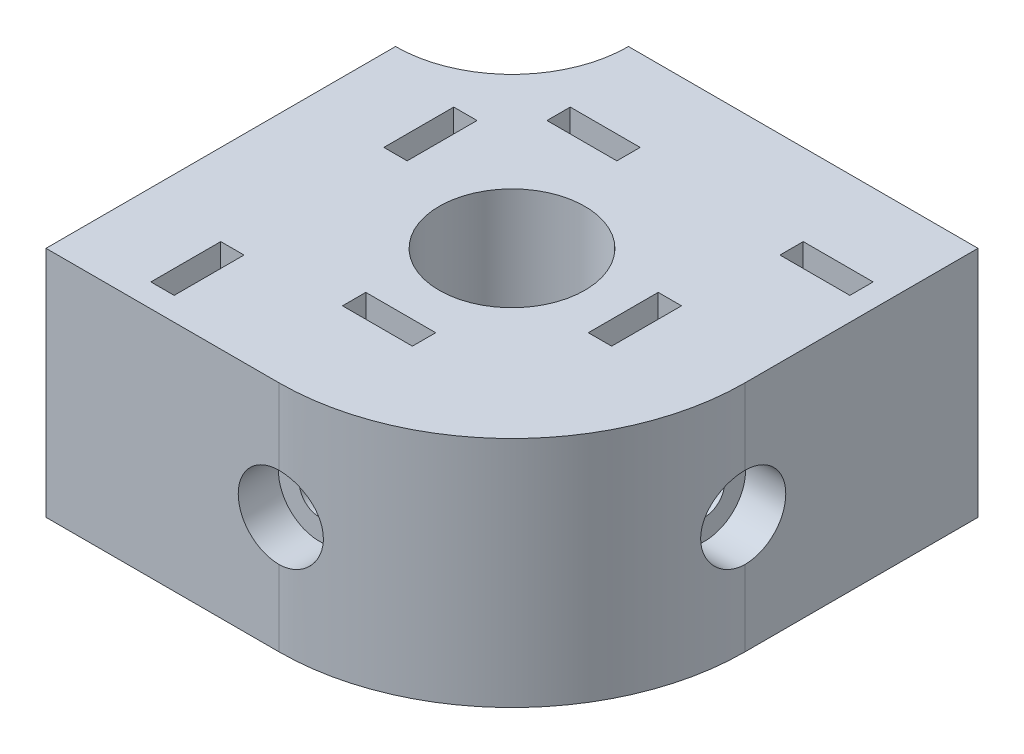
from build123d import *

# Parameters (mm, degrees)
SKETCH1_W               = 40
SKETCH1_H               = 40
SKETCH1_R               = 6.25
BOSS_EXTRUDE1_DEPTH     = 20
SKETCH2_R               = 1.7
CUT_EXTRUDE1_DEPTH      = 11
CUT_EXTRUDE2_START      = -7
CUT_EXTRUDE2_DEPTH      = 2
CUT_EXTRUDE3_REACH      = 50.99
CUT_EXTRUDE3_END_RADIUS = 6.25
SKETCH4_R               = 1.7
CUT_EXTRUDE4_START      = -8.45
CUT_EXTRUDE4_DEPTH      = 2
SKETCH6_R               = 3.5
CUT_EXTRUDE5_DEPTH      = 3.45
FILLET1_R               = 20
CUT_EXTRUDE6_DEPTH      = 35.641016325


with BuildPart() as part:
    # Sketch1 → Boss-Extrude1 (new body)
    with BuildSketch(Plane(origin=(0, 0, 0), x_dir=(1, 0, 0), z_dir=(0, 1, 0))):
        Rectangle(SKETCH1_W, SKETCH1_H)
        with Locations(Location((0, 0, 0), (0, 0, 270))):
            Circle(SKETCH1_R, mode=Mode.SUBTRACT)
    extrude(amount=BOSS_EXTRUDE1_DEPTH)

    # Sketch2 → Cut-Extrude1 (cut)
    with BuildSketch(Plane.ZY.offset(20)):
        with Locations((-5, 15)):
            Circle(SKETCH2_R)
        with Locations((15, 15)):
            Circle(SKETCH2_R)
        with Locations((0, 5)):
            Circle(SKETCH2_R)
    cut_extrude1 = extrude(amount=-CUT_EXTRUDE1_DEPTH, mode=Mode.SUBTRACT)

    # Sketch3 → Cut-Extrude2 (cut)
    with BuildSketch(Plane.ZY.offset(20).offset(CUT_EXTRUDE2_START)):
        Polygon((-8, 12), (-2, 12), (-2, 18), (-2, 20), (-8, 20), (-8, 18), align=None)
        Polygon((12, 12), (18, 12), (18, 18), (18, 20), (12, 20), (12, 18), align=None)
        Polygon((-3, 8), (3, 8), (3, 2), (3, 0), (-3, 0), (-3, 2), align=None)
    cut_extrude2 = extrude(amount=-CUT_EXTRUDE2_DEPTH, mode=Mode.SUBTRACT)

    # Cut-Extrude3: up to this cylinder (the profile starts outside it)
    cut_extrude3_end = Plane(origin=(0, 10, 0), z_dir=(0, -1, 0)) * Cylinder(CUT_EXTRUDE3_END_RADIUS, 115.48, mode=Mode.PRIVATE)
    # Sketch4 → Cut-Extrude3 (cut, up to the surface)
    with BuildSketch(Plane.XY.offset(20), mode=Mode.PRIVATE) as cut_extrude3_sk1:
        with Locations((0, 10)):
            Circle(SKETCH4_R)
    cut_extrude3_tool1 = extrude(cut_extrude3_sk1.sketch, amount=-CUT_EXTRUDE3_REACH, mode=Mode.PRIVATE) - cut_extrude3_end
    cut_extrude3 = cut_extrude3_tool1.solids().sort_by_distance((0, 10, 20))[0]
    add(cut_extrude3, mode=Mode.SUBTRACT)

    # Sketch5 → Cut-Extrude4 (cut)
    with BuildSketch(Plane.XY.offset(20).offset(CUT_EXTRUDE4_START)):
        Polygon((-3, 13), (-3, 20), (3, 20), (3, 13), (3, 7), (-3, 7), align=None)
    cut_extrude4 = extrude(amount=-CUT_EXTRUDE4_DEPTH, mode=Mode.SUBTRACT)

    # Sketch6 → Cut-Extrude5 (cut)
    with BuildSketch(Plane.XY.offset(20)):
        with Locations((0, 10)):
            Circle(SKETCH6_R)
    cut_extrude5 = extrude(amount=-CUT_EXTRUDE5_DEPTH, mode=Mode.SUBTRACT)

    # Mirror1: Cut-Extrude1, Cut-Extrude2, Cut-Extrude3, Cut-Extrude4, Cut-Extrude5 across plane
    add(cut_extrude1.mirror(Plane(origin=(0, 0, 0), x_dir=(0.7071067811865476, 0, 0.7071067811865476), z_dir=(-0.7071067811865477, 0, 0.7071067811865475))), mode=Mode.SUBTRACT)
    add(cut_extrude2.mirror(Plane(origin=(0, 0, 0), x_dir=(0.7071067811865476, 0, 0.7071067811865476), z_dir=(-0.7071067811865477, 0, 0.7071067811865475))), mode=Mode.SUBTRACT)
    add(cut_extrude3.mirror(Plane(origin=(0, 0, 0), x_dir=(0.7071067811865476, 0, 0.7071067811865476), z_dir=(-0.7071067811865477, 0, 0.7071067811865475))), mode=Mode.SUBTRACT)
    add(cut_extrude4.mirror(Plane(origin=(0, 0, 0), x_dir=(0.7071067811865476, 0, 0.7071067811865476), z_dir=(-0.7071067811865477, 0, 0.7071067811865475))), mode=Mode.SUBTRACT)
    add(cut_extrude5.mirror(Plane(origin=(0, 0, 0), x_dir=(0.7071067811865476, 0, 0.7071067811865476), z_dir=(-0.7071067811865477, 0, 0.7071067811865475))), mode=Mode.SUBTRACT)

    # Fillet1
    # the kernel refuses this fillet: 20 mm, written as the material it takes off along each edge
    with BuildSketch(Plane(origin=(20, -50, 20), x_dir=(-1, 0, 0), z_dir=(0, 1, 0))) as fillet1_piece_1:
        with BuildLine():
            CenterArc((FILLET1_R, -FILLET1_R), FILLET1_R, 90, 90)
            Line((0, -FILLET1_R), (0, 0))
            Line((0, 0), (FILLET1_R, 0))
        make_face()
    extrude(amount=120, mode=Mode.SUBTRACT)

    # Sketch7 → Cut-Extrude6 (cut, through all)
    with BuildSketch(Plane(origin=(0, 20, 0), x_dir=(1, 0, 0), z_dir=(0, 1, 0))):
        with BuildLine():
            Line((-20, 10), (-20, 20))
            Line((-20, 20), (-10, 20))
            ThreePointArc((-10, 20), (-12.928932188, 12.928932188), (-20, 10))
        make_face()
    extrude(amount=-CUT_EXTRUDE6_DEPTH, mode=Mode.SUBTRACT)


solid = part.part
